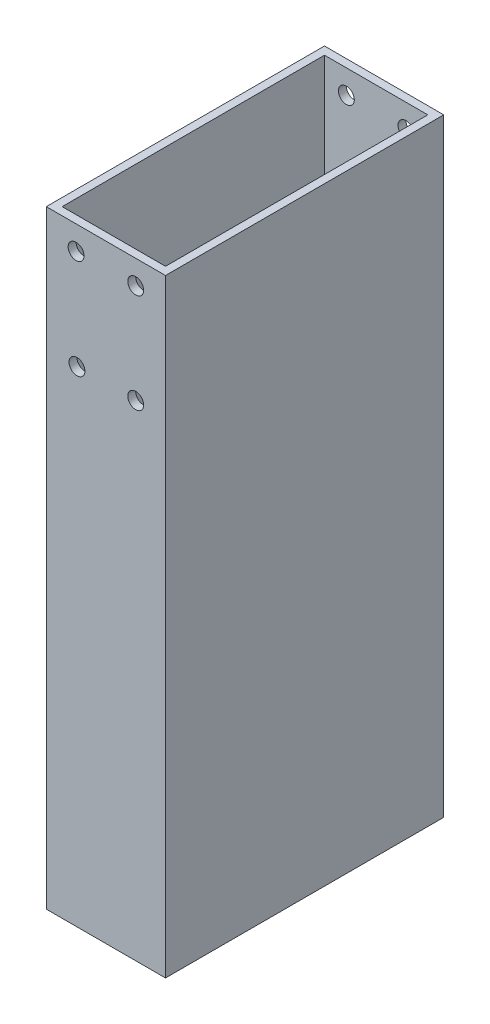
from build123d import *

# Parameters (mm, degrees)
SKETCH_1_W          = 30
SKETCH_1_H          = 766.14
SKETCH_1_R          = 2
EXTRUDE_2_DEPTH     = 70
SKETCH_2_W          = 26
SKETCH_2_H          = 66
CUT_EXTRUDE_3_DEPTH = 770.477419812
SKETCH_3_W          = 30
SKETCH_3_H          = 624.936750841
CUT_EXTRUDE_4_DEPTH = 390.70196933


with BuildPart() as part:
    # 草图1 → 凸台-拉伸2 (new body)
    with BuildSketch(Plane.XY):
        Rectangle(SKETCH_1_W, SKETCH_1_H)
        with Locations((-7.5, 377.074776011)):
            Circle(SKETCH_1_R, mode=Mode.SUBTRACT)
        with Locations((7.5, 377.074776011)):
            Circle(SKETCH_1_R, mode=Mode.SUBTRACT)
        with Locations((-7.274687816, 352.074776011)):
            Circle(SKETCH_1_R, mode=Mode.SUBTRACT)
        with Locations((7.5, 352.074776011)):
            Circle(SKETCH_1_R, mode=Mode.SUBTRACT)
    extrude(amount=EXTRUDE_2_DEPTH)

    # 草图2 → 切除-拉伸3 (cut, through all)
    with BuildSketch(Plane.XZ.offset(383.07)):
        with Locations((0, 35)):
            Rectangle(SKETCH_2_W, SKETCH_2_H)
    extrude(amount=-CUT_EXTRUDE_3_DEPTH, mode=Mode.SUBTRACT)

    # 草图3 → 切除-拉伸4 (cut, through all)
    with BuildSketch(Plane.XY.offset(70)):
        with Locations((0, -82.468375421)):
            Rectangle(SKETCH_3_W, SKETCH_3_H)
    extrude(amount=-CUT_EXTRUDE_4_DEPTH, mode=Mode.SUBTRACT)


solid = part.part
